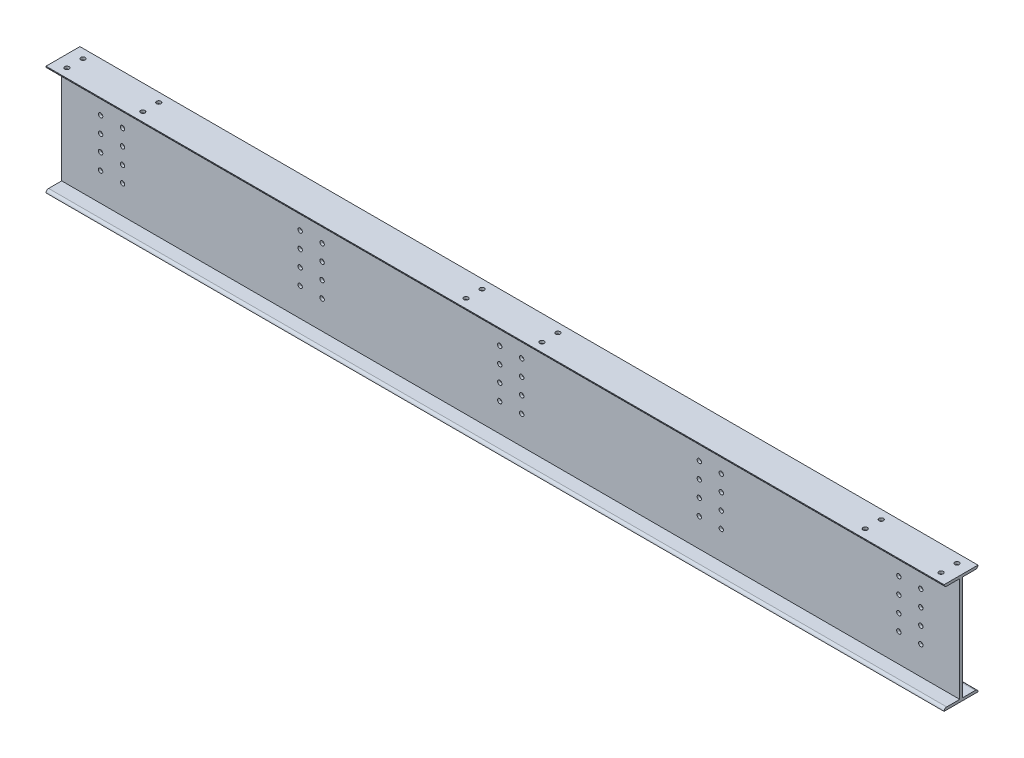
from build123d import *

# Parameters (mm, degrees)
SKETCH_1_W                        = 4500
SKETCH_1_H                        = 550
EXTRUDE_1_DEPTH                   = 170
SKETCH_2_R                        = 11
CUT_EXTRUDE_1_DEPTH               = 4537.672789611
PATTERN_LINEAR_1_COUNT            = 2
PATTERN_LINEAR_1_PITCH            = 110
PATTERN_LINEAR_1_COUNT_DIR2       = 4
PATTERN_LINEAR_1_PITCH_DIR2       = 80
PATTERN_LINEAR_2_COUNT            = 5
PATTERN_LINEAR_2_PITCH            = 1000
PATTERN_LINEAR_2_COPY_1_SKETCH_R  = 11
PATTERN_LINEAR_2_COPY_1_DEPTH     = 4537.672789611
PATTERN_LINEAR_2_COPY_2_SKETCH_R  = 11
PATTERN_LINEAR_2_COPY_2_DEPTH     = 4537.672789611
PATTERN_LINEAR_2_COPY_3_SKETCH_R  = 11
PATTERN_LINEAR_2_COPY_3_DEPTH     = 4537.672789611
PATTERN_LINEAR_2_COPY_4_SKETCH_R  = 11
PATTERN_LINEAR_2_COPY_4_DEPTH     = 4537.672789611
PATTERN_LINEAR_2_COPY_5_SKETCH_R  = 11
PATTERN_LINEAR_2_COPY_5_DEPTH     = 4537.672789611
PATTERN_LINEAR_2_COPY_6_SKETCH_R  = 11
PATTERN_LINEAR_2_COPY_6_DEPTH     = 4537.672789611
PATTERN_LINEAR_2_COPY_7_SKETCH_R  = 11
PATTERN_LINEAR_2_COPY_7_DEPTH     = 4537.672789611
PATTERN_LINEAR_2_COPY_8_SKETCH_R  = 11
PATTERN_LINEAR_2_COPY_8_DEPTH     = 4537.672789611
PATTERN_LINEAR_2_COPY_9_SKETCH_R  = 11
PATTERN_LINEAR_2_COPY_9_DEPTH     = 4537.672789611
PATTERN_LINEAR_2_COPY_10_SKETCH_R = 11
PATTERN_LINEAR_2_COPY_10_DEPTH    = 4537.672789611
PATTERN_LINEAR_2_COPY_11_SKETCH_R = 11
PATTERN_LINEAR_2_COPY_11_DEPTH    = 4537.672789611
PATTERN_LINEAR_2_COPY_12_SKETCH_R = 11
PATTERN_LINEAR_2_COPY_12_DEPTH    = 4537.672789611
PATTERN_LINEAR_2_COPY_13_SKETCH_R = 11
PATTERN_LINEAR_2_COPY_13_DEPTH    = 4537.672789611
PATTERN_LINEAR_2_COPY_14_SKETCH_R = 11
PATTERN_LINEAR_2_COPY_14_DEPTH    = 4537.672789611
PATTERN_LINEAR_2_COPY_15_SKETCH_R = 11
PATTERN_LINEAR_2_COPY_15_DEPTH    = 4537.672789611
PATTERN_LINEAR_2_COPY_16_SKETCH_R = 11
PATTERN_LINEAR_2_COPY_16_DEPTH    = 4537.672789611
PATTERN_LINEAR_2_COPY_17_SKETCH_R = 11
PATTERN_LINEAR_2_COPY_17_DEPTH    = 4537.672789611
PATTERN_LINEAR_2_COPY_18_SKETCH_R = 11
PATTERN_LINEAR_2_COPY_18_DEPTH    = 4537.672789611
PATTERN_LINEAR_2_COPY_19_SKETCH_R = 11
PATTERN_LINEAR_2_COPY_19_DEPTH    = 4537.672789611
PATTERN_LINEAR_2_COPY_20_SKETCH_R = 11
PATTERN_LINEAR_2_COPY_20_DEPTH    = 4537.672789611
PATTERN_LINEAR_2_COPY_21_SKETCH_R = 11
PATTERN_LINEAR_2_COPY_21_DEPTH    = 4537.672789611
PATTERN_LINEAR_2_COPY_22_SKETCH_R = 11
PATTERN_LINEAR_2_COPY_22_DEPTH    = 4537.672789611
PATTERN_LINEAR_2_COPY_23_SKETCH_R = 11
PATTERN_LINEAR_2_COPY_23_DEPTH    = 4537.672789611
PATTERN_LINEAR_2_COPY_24_SKETCH_R = 11
PATTERN_LINEAR_2_COPY_24_DEPTH    = 4537.672789611
PATTERN_LINEAR_2_COPY_25_SKETCH_R = 11
PATTERN_LINEAR_2_COPY_25_DEPTH    = 4537.672789611
PATTERN_LINEAR_2_COPY_26_SKETCH_R = 11
PATTERN_LINEAR_2_COPY_26_DEPTH    = 4537.672789611
PATTERN_LINEAR_2_COPY_27_SKETCH_R = 11
PATTERN_LINEAR_2_COPY_27_DEPTH    = 4537.672789611
PATTERN_LINEAR_2_COPY_28_SKETCH_R = 11
PATTERN_LINEAR_2_COPY_28_DEPTH    = 4537.672789611
SKETCH_4_R                        = 11
CUT_EXTRUDE_2_DEPTH               = 200
PATTERN_LINEAR_3_COUNT            = 2
PATTERN_LINEAR_3_PITCH            = 380
PATTERN_LINEAR_4_COUNT            = 3
PATTERN_LINEAR_4_PITCH            = 2000
PATTERN_LINEAR_4_COPY_1_SKETCH_R  = 11
PATTERN_LINEAR_4_COPY_1_DEPTH     = 200
PATTERN_LINEAR_4_COPY_2_SKETCH_R  = 11
PATTERN_LINEAR_4_COPY_2_DEPTH     = 200
SKETCH_7_W                        = 78.5
SKETCH_7_H                        = 524
CUT_EXTRUDE_3_DEPTH               = 4537.672789611
FILLET_1_R                        = 13
FILLET_2_R                        = 13
FILLET_3_R                        = 13
FILLET_4_R                        = 13


with BuildPart() as part:
    # 草图1 → 拉伸1 (new body)
    with BuildSketch(Plane.XY):
        with Locations((2250, 275)):
            Rectangle(SKETCH_1_W, SKETCH_1_H)
    extrude(amount=EXTRUDE_1_DEPTH)

    # 草图2 → 切除-拉伸1 (cut, through all)
    with BuildSketch(Plane.XY.offset(170)):
        with Locations((195, 155)):
            Circle(SKETCH_2_R)
    cut_extrude_1 = extrude(amount=-CUT_EXTRUDE_1_DEPTH, mode=Mode.SUBTRACT)

    # 阵列(线性)1: Cut-Extrude 1 2 × 4
    with Locations(*[(i * PATTERN_LINEAR_1_PITCH, j * PATTERN_LINEAR_1_PITCH_DIR2, 0) for i in range(PATTERN_LINEAR_1_COUNT) for j in range(PATTERN_LINEAR_1_COUNT_DIR2) if (i, j) != (0, 0)]):
        add(cut_extrude_1, mode=Mode.SUBTRACT)

    # 阵列(线性)2: 切除-拉伸1 ×5
    with Locations(*[(i * PATTERN_LINEAR_2_PITCH, 0, 0) for i in range(1, PATTERN_LINEAR_2_COUNT)]):
        add(cut_extrude_1, mode=Mode.SUBTRACT)

    # 阵列(线性)2 copy 1 sketch → 阵列(线性)2 copy 1 (cut, through all)
    with BuildSketch(Plane(origin=(1000, 80, 170), x_dir=(1, 0, 0), z_dir=(0, 0, 1))):
        with Locations((195, 155)):
            Circle(PATTERN_LINEAR_2_COPY_1_SKETCH_R)
    extrude(amount=-PATTERN_LINEAR_2_COPY_1_DEPTH, mode=Mode.SUBTRACT)

    # 阵列(线性)2 copy 2 sketch → 阵列(线性)2 copy 2 (cut, through all)
    with BuildSketch(Plane(origin=(2000, 80, 170), x_dir=(1, 0, 0), z_dir=(0, 0, 1))):
        with Locations((195, 155)):
            Circle(PATTERN_LINEAR_2_COPY_2_SKETCH_R)
    extrude(amount=-PATTERN_LINEAR_2_COPY_2_DEPTH, mode=Mode.SUBTRACT)

    # 阵列(线性)2 copy 3 sketch → 阵列(线性)2 copy 3 (cut, through all)
    with BuildSketch(Plane(origin=(3000, 80, 170), x_dir=(1, 0, 0), z_dir=(0, 0, 1))):
        with Locations((195, 155)):
            Circle(PATTERN_LINEAR_2_COPY_3_SKETCH_R)
    extrude(amount=-PATTERN_LINEAR_2_COPY_3_DEPTH, mode=Mode.SUBTRACT)

    # 阵列(线性)2 copy 4 sketch → 阵列(线性)2 copy 4 (cut, through all)
    with BuildSketch(Plane(origin=(4000, 80, 170), x_dir=(1, 0, 0), z_dir=(0, 0, 1))):
        with Locations((195, 155)):
            Circle(PATTERN_LINEAR_2_COPY_4_SKETCH_R)
    extrude(amount=-PATTERN_LINEAR_2_COPY_4_DEPTH, mode=Mode.SUBTRACT)

    # 阵列(线性)2 copy 5 sketch → 阵列(线性)2 copy 5 (cut, through all)
    with BuildSketch(Plane(origin=(1000, 160, 170), x_dir=(1, 0, 0), z_dir=(0, 0, 1))):
        with Locations((195, 155)):
            Circle(PATTERN_LINEAR_2_COPY_5_SKETCH_R)
    extrude(amount=-PATTERN_LINEAR_2_COPY_5_DEPTH, mode=Mode.SUBTRACT)

    # 阵列(线性)2 copy 6 sketch → 阵列(线性)2 copy 6 (cut, through all)
    with BuildSketch(Plane(origin=(2000, 160, 170), x_dir=(1, 0, 0), z_dir=(0, 0, 1))):
        with Locations((195, 155)):
            Circle(PATTERN_LINEAR_2_COPY_6_SKETCH_R)
    extrude(amount=-PATTERN_LINEAR_2_COPY_6_DEPTH, mode=Mode.SUBTRACT)

    # 阵列(线性)2 copy 7 sketch → 阵列(线性)2 copy 7 (cut, through all)
    with BuildSketch(Plane(origin=(3000, 160, 170), x_dir=(1, 0, 0), z_dir=(0, 0, 1))):
        with Locations((195, 155)):
            Circle(PATTERN_LINEAR_2_COPY_7_SKETCH_R)
    extrude(amount=-PATTERN_LINEAR_2_COPY_7_DEPTH, mode=Mode.SUBTRACT)

    # 阵列(线性)2 copy 8 sketch → 阵列(线性)2 copy 8 (cut, through all)
    with BuildSketch(Plane(origin=(4000, 160, 170), x_dir=(1, 0, 0), z_dir=(0, 0, 1))):
        with Locations((195, 155)):
            Circle(PATTERN_LINEAR_2_COPY_8_SKETCH_R)
    extrude(amount=-PATTERN_LINEAR_2_COPY_8_DEPTH, mode=Mode.SUBTRACT)

    # 阵列(线性)2 copy 9 sketch → 阵列(线性)2 copy 9 (cut, through all)
    with BuildSketch(Plane(origin=(1000, 240, 170), x_dir=(1, 0, 0), z_dir=(0, 0, 1))):
        with Locations((195, 155)):
            Circle(PATTERN_LINEAR_2_COPY_9_SKETCH_R)
    extrude(amount=-PATTERN_LINEAR_2_COPY_9_DEPTH, mode=Mode.SUBTRACT)

    # 阵列(线性)2 copy 10 sketch → 阵列(线性)2 copy 10 (cut, through all)
    with BuildSketch(Plane(origin=(2000, 240, 170), x_dir=(1, 0, 0), z_dir=(0, 0, 1))):
        with Locations((195, 155)):
            Circle(PATTERN_LINEAR_2_COPY_10_SKETCH_R)
    extrude(amount=-PATTERN_LINEAR_2_COPY_10_DEPTH, mode=Mode.SUBTRACT)

    # 阵列(线性)2 copy 11 sketch → 阵列(线性)2 copy 11 (cut, through all)
    with BuildSketch(Plane(origin=(3000, 240, 170), x_dir=(1, 0, 0), z_dir=(0, 0, 1))):
        with Locations((195, 155)):
            Circle(PATTERN_LINEAR_2_COPY_11_SKETCH_R)
    extrude(amount=-PATTERN_LINEAR_2_COPY_11_DEPTH, mode=Mode.SUBTRACT)

    # 阵列(线性)2 copy 12 sketch → 阵列(线性)2 copy 12 (cut, through all)
    with BuildSketch(Plane(origin=(4000, 240, 170), x_dir=(1, 0, 0), z_dir=(0, 0, 1))):
        with Locations((195, 155)):
            Circle(PATTERN_LINEAR_2_COPY_12_SKETCH_R)
    extrude(amount=-PATTERN_LINEAR_2_COPY_12_DEPTH, mode=Mode.SUBTRACT)

    # 阵列(线性)2 copy 13 sketch → 阵列(线性)2 copy 13 (cut, through all)
    with BuildSketch(Plane(origin=(1110, 0, 170), x_dir=(1, 0, 0), z_dir=(0, 0, 1))):
        with Locations((195, 155)):
            Circle(PATTERN_LINEAR_2_COPY_13_SKETCH_R)
    extrude(amount=-PATTERN_LINEAR_2_COPY_13_DEPTH, mode=Mode.SUBTRACT)

    # 阵列(线性)2 copy 14 sketch → 阵列(线性)2 copy 14 (cut, through all)
    with BuildSketch(Plane(origin=(2110, 0, 170), x_dir=(1, 0, 0), z_dir=(0, 0, 1))):
        with Locations((195, 155)):
            Circle(PATTERN_LINEAR_2_COPY_14_SKETCH_R)
    extrude(amount=-PATTERN_LINEAR_2_COPY_14_DEPTH, mode=Mode.SUBTRACT)

    # 阵列(线性)2 copy 15 sketch → 阵列(线性)2 copy 15 (cut, through all)
    with BuildSketch(Plane(origin=(3110, 0, 170), x_dir=(1, 0, 0), z_dir=(0, 0, 1))):
        with Locations((195, 155)):
            Circle(PATTERN_LINEAR_2_COPY_15_SKETCH_R)
    extrude(amount=-PATTERN_LINEAR_2_COPY_15_DEPTH, mode=Mode.SUBTRACT)

    # 阵列(线性)2 copy 16 sketch → 阵列(线性)2 copy 16 (cut, through all)
    with BuildSketch(Plane(origin=(4110, 0, 170), x_dir=(1, 0, 0), z_dir=(0, 0, 1))):
        with Locations((195, 155)):
            Circle(PATTERN_LINEAR_2_COPY_16_SKETCH_R)
    extrude(amount=-PATTERN_LINEAR_2_COPY_16_DEPTH, mode=Mode.SUBTRACT)

    # 阵列(线性)2 copy 17 sketch → 阵列(线性)2 copy 17 (cut, through all)
    with BuildSketch(Plane(origin=(1110, 80, 170), x_dir=(1, 0, 0), z_dir=(0, 0, 1))):
        with Locations((195, 155)):
            Circle(PATTERN_LINEAR_2_COPY_17_SKETCH_R)
    extrude(amount=-PATTERN_LINEAR_2_COPY_17_DEPTH, mode=Mode.SUBTRACT)

    # 阵列(线性)2 copy 18 sketch → 阵列(线性)2 copy 18 (cut, through all)
    with BuildSketch(Plane(origin=(2110, 80, 170), x_dir=(1, 0, 0), z_dir=(0, 0, 1))):
        with Locations((195, 155)):
            Circle(PATTERN_LINEAR_2_COPY_18_SKETCH_R)
    extrude(amount=-PATTERN_LINEAR_2_COPY_18_DEPTH, mode=Mode.SUBTRACT)

    # 阵列(线性)2 copy 19 sketch → 阵列(线性)2 copy 19 (cut, through all)
    with BuildSketch(Plane(origin=(3110, 80, 170), x_dir=(1, 0, 0), z_dir=(0, 0, 1))):
        with Locations((195, 155)):
            Circle(PATTERN_LINEAR_2_COPY_19_SKETCH_R)
    extrude(amount=-PATTERN_LINEAR_2_COPY_19_DEPTH, mode=Mode.SUBTRACT)

    # 阵列(线性)2 copy 20 sketch → 阵列(线性)2 copy 20 (cut, through all)
    with BuildSketch(Plane(origin=(4110, 80, 170), x_dir=(1, 0, 0), z_dir=(0, 0, 1))):
        with Locations((195, 155)):
            Circle(PATTERN_LINEAR_2_COPY_20_SKETCH_R)
    extrude(amount=-PATTERN_LINEAR_2_COPY_20_DEPTH, mode=Mode.SUBTRACT)

    # 阵列(线性)2 copy 21 sketch → 阵列(线性)2 copy 21 (cut, through all)
    with BuildSketch(Plane(origin=(1110, 160, 170), x_dir=(1, 0, 0), z_dir=(0, 0, 1))):
        with Locations((195, 155)):
            Circle(PATTERN_LINEAR_2_COPY_21_SKETCH_R)
    extrude(amount=-PATTERN_LINEAR_2_COPY_21_DEPTH, mode=Mode.SUBTRACT)

    # 阵列(线性)2 copy 22 sketch → 阵列(线性)2 copy 22 (cut, through all)
    with BuildSketch(Plane(origin=(2110, 160, 170), x_dir=(1, 0, 0), z_dir=(0, 0, 1))):
        with Locations((195, 155)):
            Circle(PATTERN_LINEAR_2_COPY_22_SKETCH_R)
    extrude(amount=-PATTERN_LINEAR_2_COPY_22_DEPTH, mode=Mode.SUBTRACT)

    # 阵列(线性)2 copy 23 sketch → 阵列(线性)2 copy 23 (cut, through all)
    with BuildSketch(Plane(origin=(3110, 160, 170), x_dir=(1, 0, 0), z_dir=(0, 0, 1))):
        with Locations((195, 155)):
            Circle(PATTERN_LINEAR_2_COPY_23_SKETCH_R)
    extrude(amount=-PATTERN_LINEAR_2_COPY_23_DEPTH, mode=Mode.SUBTRACT)

    # 阵列(线性)2 copy 24 sketch → 阵列(线性)2 copy 24 (cut, through all)
    with BuildSketch(Plane(origin=(4110, 160, 170), x_dir=(1, 0, 0), z_dir=(0, 0, 1))):
        with Locations((195, 155)):
            Circle(PATTERN_LINEAR_2_COPY_24_SKETCH_R)
    extrude(amount=-PATTERN_LINEAR_2_COPY_24_DEPTH, mode=Mode.SUBTRACT)

    # 阵列(线性)2 copy 25 sketch → 阵列(线性)2 copy 25 (cut, through all)
    with BuildSketch(Plane(origin=(1110, 240, 170), x_dir=(1, 0, 0), z_dir=(0, 0, 1))):
        with Locations((195, 155)):
            Circle(PATTERN_LINEAR_2_COPY_25_SKETCH_R)
    extrude(amount=-PATTERN_LINEAR_2_COPY_25_DEPTH, mode=Mode.SUBTRACT)

    # 阵列(线性)2 copy 26 sketch → 阵列(线性)2 copy 26 (cut, through all)
    with BuildSketch(Plane(origin=(2110, 240, 170), x_dir=(1, 0, 0), z_dir=(0, 0, 1))):
        with Locations((195, 155)):
            Circle(PATTERN_LINEAR_2_COPY_26_SKETCH_R)
    extrude(amount=-PATTERN_LINEAR_2_COPY_26_DEPTH, mode=Mode.SUBTRACT)

    # 阵列(线性)2 copy 27 sketch → 阵列(线性)2 copy 27 (cut, through all)
    with BuildSketch(Plane(origin=(3110, 240, 170), x_dir=(1, 0, 0), z_dir=(0, 0, 1))):
        with Locations((195, 155)):
            Circle(PATTERN_LINEAR_2_COPY_27_SKETCH_R)
    extrude(amount=-PATTERN_LINEAR_2_COPY_27_DEPTH, mode=Mode.SUBTRACT)

    # 阵列(线性)2 copy 28 sketch → 阵列(线性)2 copy 28 (cut, through all)
    with BuildSketch(Plane(origin=(4110, 240, 170), x_dir=(1, 0, 0), z_dir=(0, 0, 1))):
        with Locations((195, 155)):
            Circle(PATTERN_LINEAR_2_COPY_28_SKETCH_R)
    extrude(amount=-PATTERN_LINEAR_2_COPY_28_DEPTH, mode=Mode.SUBTRACT)

    # 草图4 → 切除-拉伸2 (cut)
    with BuildSketch(Plane(origin=(0, 550, 0), x_dir=(1, 0, 0), z_dir=(0, 1, 0))):
        with Locations(Location((60, -125, 0), (0, 0, 270))):
            Circle(SKETCH_4_R)
        with Locations(Location((60, -45, 0), (0, 0, 270))):
            Circle(SKETCH_4_R)
    cut_extrude_2 = extrude(amount=-CUT_EXTRUDE_2_DEPTH, mode=Mode.SUBTRACT)

    # 阵列(线性)3: 切除-拉伸2 ×2
    with Locations(*[(i * PATTERN_LINEAR_3_PITCH, 0, 0) for i in range(1, PATTERN_LINEAR_3_COUNT)]):
        add(cut_extrude_2, mode=Mode.SUBTRACT)

    # 阵列(线性)4: 切除-拉伸2 ×3
    with Locations(*[(i * PATTERN_LINEAR_4_PITCH, 0, 0) for i in range(1, PATTERN_LINEAR_4_COUNT)]):
        add(cut_extrude_2, mode=Mode.SUBTRACT)

    # 阵列(线性)4 copy 1 sketch → 阵列(线性)4 copy 1 (cut)
    with BuildSketch(Plane(origin=(2380, 550, 0), x_dir=(1, 0, 0), z_dir=(0, 1, 0))):
        with Locations(Location((60, -125, 0), (0, 0, 270))):
            Circle(PATTERN_LINEAR_4_COPY_1_SKETCH_R)
        with Locations(Location((60, -45, 0), (0, 0, 270))):
            Circle(PATTERN_LINEAR_4_COPY_1_SKETCH_R)
    extrude(amount=-PATTERN_LINEAR_4_COPY_1_DEPTH, mode=Mode.SUBTRACT)

    # 阵列(线性)4 copy 2 sketch → 阵列(线性)4 copy 2 (cut)
    with BuildSketch(Plane(origin=(4380, 550, 0), x_dir=(1, 0, 0), z_dir=(0, 1, 0))):
        with Locations(Location((60, -125, 0), (0, 0, 270))):
            Circle(PATTERN_LINEAR_4_COPY_2_SKETCH_R)
        with Locations(Location((60, -45, 0), (0, 0, 270))):
            Circle(PATTERN_LINEAR_4_COPY_2_SKETCH_R)
    extrude(amount=-PATTERN_LINEAR_4_COPY_2_DEPTH, mode=Mode.SUBTRACT)

    # 草图7 → 切除-拉伸3 (cut, through all)
    with BuildSketch(Plane.ZY):
        with Locations((130.75, 275)):
            Rectangle(SKETCH_7_W, SKETCH_7_H)
        with Locations((39.25, 275)):
            Rectangle(SKETCH_7_W, SKETCH_7_H)
    extrude(amount=-CUT_EXTRUDE_3_DEPTH, mode=Mode.SUBTRACT)

    # 圆角1
    fillet_1_edges = [part.edges().sort_by_distance(p)[0] for p in [
        (2250, 537, 0),
    ]]
    fillet(fillet_1_edges, radius=FILLET_1_R - 0.0001)  # a hair under: the kernel refuses the full size

    # 圆角2
    fillet_2_edges = [part.edges().sort_by_distance(p)[0] for p in [
        (2250, 537, 170),
    ]]
    fillet(fillet_2_edges, radius=FILLET_2_R - 0.0001)  # a hair under: the kernel refuses the full size

    # 圆角3
    fillet_3_edges = [part.edges().sort_by_distance(p)[0] for p in [
        (2250, 13, 0),
    ]]
    fillet(fillet_3_edges, radius=FILLET_3_R - 0.0001)  # a hair under: the kernel refuses the full size

    # 圆角4
    fillet_4_edges = [part.edges().sort_by_distance(p)[0] for p in [
        (2250, 13, 170),
    ]]
    fillet(fillet_4_edges, radius=FILLET_4_R - 0.0001)  # a hair under: the kernel refuses the full size


solid = part.part
